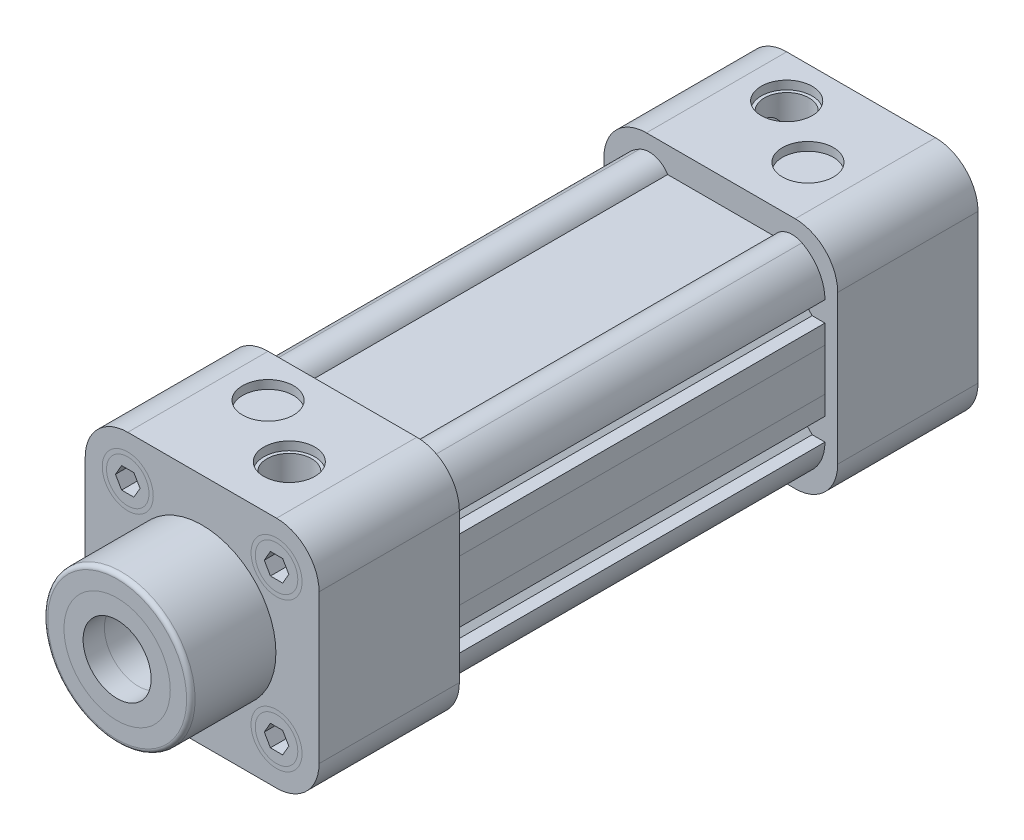
from build123d import *
from build123d.topology import SkipClean

# Parameters (mm, degrees)
IZIM1_W                        = 55
IZIM1_H                        = 55
Y_KSEKLIK_EKSTR_ZYON2_DEPTH    = 155
IZIM2_W                        = 89
IZIM2_H                        = 3.892926892
IZIM2_H_2                      = 3
KES_EKSTR_ZYON3_DEPTH          = 155
IZIM3_W                        = 3
IZIM3_H                        = 89
KES_EKSTR_ZYON4_DEPTH          = 155
IZIM4_W                        = 89
IZIM4_H                        = 3
KES_EKSTR_ZYON5_DEPTH          = 155
IZIM5_W                        = 3
IZIM5_H                        = 89
KES_EKSTR_ZYON6_DEPTH          = 155
KES_EKSTR_ZYON7_DEPTH          = 3
RADYUS1_R                      = 10
RADYUS4_R                      = 5
IZIM7_W                        = 89
IZIM7_H                        = 4.75
IZIM7_H_2                      = 5.25
KES_EKSTR_ZYON8_DEPTH          = 7
PAH1_SIZE                      = 4
IZIM8_W                        = 89
IZIM8_H                        = 10
KES_EKSTR_ZYON9_DEPTH          = 5
IZIM9_W                        = 89
IZIM9_H                        = 10
Y_KSEKLIK_EKSTR_ZYON3_DEPTH    = 5
IZIM10_W                       = 89
IZIM10_H                       = 10
KES_EKSTR_ZYON10_DEPTH         = 2.5
IZIM11_R                       = 17.35
Y_KSEKLIK_EKSTR_ZYON4_DEPTH    = 20
RADYUS5_R                      = 1
IZIM12_R                       = 6
KES_EKSTR_ZYON11_DEPTH         = 20
IZIM13_R                       = 5
Y_KSEKLIK_EKSTR_ZYON5_DEPTH    = 20
Y_KSEKLIK_EKSTR_ZYON5_2_DEPTH  = 20
Y_KSEKLIK_EKSTR_ZYON5_3_DEPTH  = 20
Y_KSEKLIK_EKSTR_ZYON5_4_DEPTH  = 20
KES_EKSTR_ZYON12_DEPTH         = 20
IZIM15_R                       = 5
Y_KSEKLIK_EKSTR_ZYON6_DEPTH    = 15
Y_KSEKLIK_EKSTR_ZYON6_2_DEPTH  = 15
Y_KSEKLIK_EKSTR_ZYON6_3_DEPTH  = 15
Y_KSEKLIK_EKSTR_ZYON6_4_DEPTH  = 15
KES_EKSTR_ZYON14_DEPTH         = 4
IZIM19_R                       = 17.5
Y_KSEKLIK_EKSTR_ZYON7_DEPTH    = 8
IZIM20_R                       = 6
KES_EKSTR_ZYON15_DEPTH         = 2
M12X1_5_START                  = 11.4999999
M12X1_5_TAPPED_HOLE1_DEPTH     = 12.0000002
IZIM22_R                       = 12.5
IZIM22_R_2                     = 8
KES_EKSTR_ZYON16_DEPTH         = 5
IZIM23_R                       = 12.5
IZIM23_R_2                     = 8
Y_KSEKLIK_EKSTR_ZYON8_DEPTH    = 5
IZIM24_R                       = 8
KES_EKSTR_ZYON17_DEPTH         = 150
M6X1_0_TAPPED_HOLE2_AT_2_COUNT = 2
M6X1_0_TAPPED_HOLE2_AT_2_PITCH = 35
M6X1_0_TAPPED_HOLE2_AT_3_COUNT = 2
M6X1_0_TAPPED_HOLE2_AT_3_PITCH = 49.497474683
M6X1_0_TAPPED_HOLE2_AT_4_COUNT = 2
M6X1_0_TAPPED_HOLE2_AT_4_PITCH = 35
IZIM29_R                       = 6
IZIM29_R_2                     = 5
Y_KSEKLIK_EKSTR_ZYON10_DEPTH   = 20
Y_KSEKLIK_EKSTR_ZYON10_2_DEPTH = 20
Y_KSEKLIK_EKSTR_ZYON10_3_DEPTH = 20
Y_KSEKLIK_EKSTR_ZYON10_4_DEPTH = 20
KES_EKSTR_ZYON18_DEPTH         = 0.5


# Read off the part's stored shape, not the designer's step: M12x1.5 Tapped Hole1
with BuildPart() as part:
    # Çizim1 → Yükseklik-Ekstrüzyon2 (new body)
    with BuildSketch(Plane.XY):
        Rectangle(IZIM1_W, IZIM1_H)
    extrude(amount=Y_KSEKLIK_EKSTR_ZYON2_DEPTH)

    # Çizim2 → Kes-Ekstrüzyon3 (cut)
    with BuildSketch(Plane(origin=(27.5, 0, 0), x_dir=(0, 0, -1), z_dir=(1, 0, 0))):
        with Locations((-77.5, 29.446463446)):
            Rectangle(IZIM2_W, IZIM2_H)
        with Locations((-77.5, 26)):
            Rectangle(IZIM2_W, IZIM2_H_2)
    extrude(amount=-KES_EKSTR_ZYON3_DEPTH, mode=Mode.SUBTRACT)

    # Çizim3 → Kes-Ekstrüzyon4 (cut)
    with BuildSketch(Plane(origin=(0, 24.5, 0), x_dir=(1, 0, 0), z_dir=(0, 1, 0))):
        with Locations((-26, -77.5)):
            Rectangle(IZIM3_W, IZIM3_H)
    extrude(amount=-KES_EKSTR_ZYON4_DEPTH, mode=Mode.SUBTRACT)

    # Çizim4 → Kes-Ekstrüzyon5 (cut)
    with BuildSketch(Plane.ZY.offset(24.5)):
        with Locations((77.5, -26)):
            Rectangle(IZIM4_W, IZIM4_H)
    extrude(amount=-KES_EKSTR_ZYON5_DEPTH, mode=Mode.SUBTRACT)

    # Çizim5 → Kes-Ekstrüzyon6 (cut)
    with BuildSketch(Plane.XZ.offset(24.5)):
        with Locations((26, 77.5)):
            Rectangle(IZIM5_W, IZIM5_H)
    extrude(amount=-KES_EKSTR_ZYON6_DEPTH, mode=Mode.SUBTRACT)

    # Çizim6 → Kes-Ekstrüzyon7 (cut)
    with BuildSketch(Plane.XZ.offset(24.5)):
        Polygon((-12.5, 33), (0, 33), (12.5, 33), (12.5, 122), (-12.5, 122), align=None)
    kes_ekstr_zyon7 = extrude(amount=-KES_EKSTR_ZYON7_DEPTH, mode=Mode.SUBTRACT)

    # Radyus1
    radyus1_edges = [part.edges().sort_by_distance(p)[0] for p in [
        (-27.5, 27.5, 16.5),
        (27.5, 27.5, 16.5),
        (-27.5, -27.5, 16.5),
        (-24.5, 24.5, 77.5),
        (27.5, -27.5, 16.5),
        (-24.5, -24.5, 77.5),
        (27.5, -27.5, 138.5),
        (-27.5, -27.5, 138.5),
        (-27.5, 27.5, 138.5),
        (27.5, 27.5, 138.5),
        (24.5, 24.5, 77.5),
        (24.5, -24.5, 77.5),
    ]]
    fillet(radyus1_edges, radius=RADYUS1_R)

    # Aynalama2: Kes-Ekstrüzyon7 across plane
    add(kes_ekstr_zyon7.mirror(Plane.ZX), mode=Mode.SUBTRACT)

    # Radyus4
    # the kernel refuses this fillet: 5 mm, written as the material it takes off along each edge
    with BuildSketch(Plane(origin=(12.5, 24.5, 33), x_dir=(0.9859548247048935, -0.16701222602295537, 0), z_dir=(0, 0, 1)), Plane(origin=(-12.5, 24.5, 122), x_dir=(-0.9859548247048942, -0.16701222602295168, 0), z_dir=(0, 0, -1))) as radyus4_piece_1:
        with BuildLine():
            CenterArc((5.163905461, -4.762761898), RADYUS4_R, 72.279451052, 86.560187232)
            Line((0.501036678, -2.957864474), (0.0347498, -2.777374732))
            ThreePointArc((0.0347498, -2.777374732), (-0.242459073, -1.56243835), (-0.492977412, -0.083506113))
            Line((-0.492977412, -0.083506113), (-0.083506113, 0.492977412))
            ThreePointArc((-0.083506113, 0.492977412), (1.888403536, 0.827001864), (6.837966368, 0.47627619))
            Line((6.837966368, 0.47627619), (6.685779013, 0))
        make_face()
    extrude(amount=89, mode=Mode.SUBTRACT)
    with BuildSketch(Plane(origin=(12.5, -24.5, 33), x_dir=(0, 1, 0), z_dir=(0, 0, 1))) as radyus4_piece_2:
        with BuildLine():
            CenterArc((5.558303418, -4.295938038), RADYUS4_R, 120.774510483, 86.560187232)
            Line((1.116606836, -6.591876075), (0.672437177, -6.821469879))
            ThreePointArc((0.672437177, -6.821469879), (-0.5, -2), (-0.5, 0))
            Line((-0.5, 0), (0, 0.5))
            ThreePointArc((0, 0.5), (1.5, 0.5), (2.744169658, 0.429593804))
            Line((2.744169658, 0.429593804), (3, 0))
        make_face()
    extrude(amount=89, mode=Mode.SUBTRACT)
    with BuildSketch(Plane(origin=(-12.5, -24.5, 122), x_dir=(-0.985954824704894, 0.16701222602295254, 0), z_dir=(0, 0, -1))) as radyus4_piece_3:
        with BuildLine():
            CenterArc((5.163905461, 4.762761898), RADYUS4_R, 201.160361716, 86.560187232)
            Line((0.501036678, 2.957864474), (0.0347498, 2.777374732))
            ThreePointArc((0.0347498, 2.777374732), (-0.242459073, 1.56243835), (-0.492977412, 0.083506113))
            Line((-0.492977412, 0.083506113), (-0.083506113, -0.492977412))
            ThreePointArc((-0.083506113, -0.492977412), (1.888403536, -0.827001864), (6.837966368, -0.47627619))
            Line((6.837966368, -0.47627619), (6.685779013, 0))
        make_face()
    extrude(amount=89, mode=Mode.SUBTRACT)

    # Çizim7 → Kes-Ekstrüzyon8 (cut)
    with BuildSketch(Plane(origin=(24.5, 0, 0), x_dir=(0, 0, -1), z_dir=(1, 0, 0))):
        with Locations((-77.5, 12.125)):
            Rectangle(IZIM7_W, IZIM7_H)
        with Locations((-77.5, -11.875)):
            Rectangle(IZIM7_W, IZIM7_H_2)
    extrude(amount=-KES_EKSTR_ZYON8_DEPTH, mode=Mode.SUBTRACT)

    # Pah1
    # the kernel refuses this chamfer: 4 mm, written as the material it adds along each edge
    with BuildSketch(Plane(origin=(17.5, 9.75, 132.286731952), x_dir=(0.9996219169112968, -0.027495876610586053, 0), z_dir=(0, 0, -1)), Plane(origin=(17.5, 14.5, 22.713268048), x_dir=(0.9996219169112968, 0.027495876610586917, 0), z_dir=(0, 0, 1)), Plane(origin=(17.5, -14.5, 132.286731952), x_dir=(0.9996219169112968, -0.027495876610586053, 0), z_dir=(0, 0, -1)), Plane(origin=(17.5, -9.25, 22.713268048), x_dir=(0.9996219169112968, 0.027495876610586917, 0), z_dir=(0, 0, 1))) as pah1_piece_1:
        Polygon((PAH1_SIZE * 0.999621916911, -PAH1_SIZE * 0.0274958766106), (-PAH1_SIZE * 0.0274958766106, -PAH1_SIZE * 0.999621916911), (0, 0), align=None)
    extrude(amount=109.573463904)

    # Çizim8 → Kes-Ekstrüzyon9 (cut)
    with BuildSketch(Plane(origin=(24.5, 0, 0), x_dir=(0, 0, -1), z_dir=(1, 0, 0))):
        with Locations((-77.5, 0.25)):
            Rectangle(IZIM8_W, IZIM8_H)
    extrude(amount=-KES_EKSTR_ZYON9_DEPTH, mode=Mode.SUBTRACT)

    # Çizim10 → Kes-Ekstrüzyon10 (cut)
    with BuildSketch(Plane.ZY.offset(24.5)):
        with Locations((77.5, 9.5)):
            Rectangle(IZIM10_W, IZIM10_H)
    extrude(amount=-KES_EKSTR_ZYON10_DEPTH, mode=Mode.SUBTRACT)

    # Çizim11 → Yükseklik-Ekstrüzyon4 (add)
    with BuildSketch(Plane.XY.offset(155)):
        Circle(IZIM11_R)
    extrude(amount=Y_KSEKLIK_EKSTR_ZYON4_DEPTH)

    # Radyus5
    radyus5_edges = [part.edges().sort_by_distance(p)[0] for p in [
        (-17.35, 0, 175),
    ]]
    fillet(radyus5_edges, radius=RADYUS5_R)

    # Çizim12 → Kes-Ekstrüzyon11 (cut)
    with BuildSketch(Plane.XY.offset(155)):
        with Locations((17.5, 17.5)):
            Circle(IZIM12_R)
        with Locations((17.5, -17.5)):
            Circle(IZIM12_R)
        with Locations((-17.5, 17.5)):
            Circle(IZIM12_R)
        with Locations((-17.5, -17.5)):
            Circle(IZIM12_R)
    kes_ekstr_zyon11 = extrude(amount=-KES_EKSTR_ZYON11_DEPTH, mode=Mode.SUBTRACT)


with BuildPart() as body_2:
    # Çizim9 → Yükseklik-Ekstrüzyon3 (new body)
    with BuildSketch(Plane(origin=(19.5, 0, 0), x_dir=(0, 0, -1), z_dir=(1, 0, 0))):
        with Locations((-77.5, 0.25)):
            Rectangle(IZIM9_W, IZIM9_H)
    extrude(amount=Y_KSEKLIK_EKSTR_ZYON3_DEPTH)


with BuildPart() as body_3:
    # Çizim13 → Yükseklik-Ekstrüzyon5 (new body)
    with BuildSketch(Plane.XY.offset(135)):
        with Locations((17.5, -17.5)):
            Circle(IZIM13_R)
    y_kseklik_ekstr_zyon5 = extrude(amount=Y_KSEKLIK_EKSTR_ZYON5_DEPTH)


with BuildPart() as body_4:
    # Çizim13 → Y_kseklik-Ekstr_zyon5 2 (new body)
    with BuildSketch(Plane.XY.offset(135)):
        with Locations((17.5, 17.5)):
            Circle(IZIM13_R)
    y_kseklik_ekstr_zyon5_2 = extrude(amount=Y_KSEKLIK_EKSTR_ZYON5_2_DEPTH)


with BuildPart() as body_5:
    # Çizim13 → Y_kseklik-Ekstr_zyon5 3 (new body)
    with BuildSketch(Plane.XY.offset(135)):
        with Locations((-17.5, 17.5)):
            Circle(IZIM13_R)
    y_kseklik_ekstr_zyon5_3 = extrude(amount=Y_KSEKLIK_EKSTR_ZYON5_3_DEPTH)


with BuildPart() as body_6:
    # Çizim13 → Y_kseklik-Ekstr_zyon5 4 (new body)
    with BuildSketch(Plane.XY.offset(135)):
        with Locations((-17.5, -17.5)):
            Circle(IZIM13_R)
    y_kseklik_ekstr_zyon5_4 = extrude(amount=Y_KSEKLIK_EKSTR_ZYON5_4_DEPTH)


with BuildPart() as kes_ekstr_zyon12_tool:
    # Çizim14 → Kes-Ekstrüzyon12 (new body)
    with BuildSketch(Plane.XY.offset(155)):
        Polygon((20.386751346, -17.5), (18.943375673, -15), (16.056624327, -15), (14.613248654, -17.5), (16.056624327, -20), (18.943375673, -20), align=None)
        Polygon((-14.613248654, -17.5), (-16.056624327, -15), (-18.943375673, -15), (-20.386751346, -17.5), (-18.943375673, -20), (-16.056624327, -20), align=None)
        Polygon((-14.613248654, 17.5), (-16.056624327, 20), (-18.943375673, 20), (-20.386751346, 17.5), (-18.943375673, 15), (-16.056624327, 15), align=None)
        Polygon((20.386751346, 17.5), (18.943375673, 20), (16.056624327, 20), (14.613248654, 17.5), (16.056624327, 15), (18.943375673, 15), align=None)
    kes_ekstr_zyon12 = extrude(amount=-KES_EKSTR_ZYON12_DEPTH)


with BuildPart() as body_3_1:
    add(body_3.part)

    # Kes-Ekstrüzyon12: cut by kes_ekstr_zyon12_tool
    add(kes_ekstr_zyon12_tool.part, mode=Mode.SUBTRACT)


with BuildPart() as body_4_1:
    add(body_4.part)

    # Kes-Ekstrüzyon12: cut by kes_ekstr_zyon12_tool
    add(kes_ekstr_zyon12_tool.part, mode=Mode.SUBTRACT)


with BuildPart() as body_5_1:
    add(body_5.part)

    # Kes-Ekstrüzyon12: cut by kes_ekstr_zyon12_tool
    add(kes_ekstr_zyon12_tool.part, mode=Mode.SUBTRACT)


with BuildPart() as body_6_1:
    add(body_6.part)

    # Kes-Ekstrüzyon12: cut by kes_ekstr_zyon12_tool
    add(kes_ekstr_zyon12_tool.part, mode=Mode.SUBTRACT)


with BuildPart() as part_1:
    add(part.part)

    # Aynalama3: Kes-Ekstrüzyon11, Yükseklik-Ekstrüzyon5, Y_kseklik-Ekstr_zyon5 2, Y_kseklik-Ekstr_zyon5 3, Y_kseklik-Ekstr_zyon5 4, Kes-Ekstrüzyon12 across plane
    add(kes_ekstr_zyon11.mirror(Plane.XY.offset(75)), mode=Mode.SUBTRACT)
    add(y_kseklik_ekstr_zyon5.mirror(Plane.XY.offset(75)), mode=Mode.SUBTRACT)
    add(y_kseklik_ekstr_zyon5_2.mirror(Plane.XY.offset(75)), mode=Mode.SUBTRACT)
    add(y_kseklik_ekstr_zyon5_3.mirror(Plane.XY.offset(75)), mode=Mode.SUBTRACT)
    add(y_kseklik_ekstr_zyon5_4.mirror(Plane.XY.offset(75)), mode=Mode.SUBTRACT)
    add(kes_ekstr_zyon12.mirror(Plane.XY.offset(75)), mode=Mode.SUBTRACT)


with BuildPart() as body_7:
    # Çizim15 → Yükseklik-Ekstrüzyon6 (new body)
    with BuildSketch(Plane(origin=(0, 0, 15), x_dir=(-1, 0, 0), z_dir=(0, 0, -1))):
        with Locations(Location((17.5, 17.5, 0), (0, 0, 180))):
            Circle(IZIM15_R)
    extrude(amount=Y_KSEKLIK_EKSTR_ZYON6_DEPTH)


with BuildPart() as body_8:
    # Çizim15 → Y_kseklik-Ekstr_zyon6 2 (new body)
    with BuildSketch(Plane(origin=(0, 0, 15), x_dir=(-1, 0, 0), z_dir=(0, 0, -1))):
        with Locations(Location((-17.5, 17.5, 0), (0, 0, 180))):
            Circle(IZIM15_R)
    extrude(amount=Y_KSEKLIK_EKSTR_ZYON6_2_DEPTH)


with BuildPart() as body_9:
    # Çizim15 → Y_kseklik-Ekstr_zyon6 3 (new body)
    with BuildSketch(Plane(origin=(0, 0, 15), x_dir=(-1, 0, 0), z_dir=(0, 0, -1))):
        with Locations(Location((-17.5, -17.5, 0), (0, 0, 180))):
            Circle(IZIM15_R)
    extrude(amount=Y_KSEKLIK_EKSTR_ZYON6_3_DEPTH)


with BuildPart() as body_10:
    # Çizim15 → Y_kseklik-Ekstr_zyon6 4 (new body)
    with BuildSketch(Plane(origin=(0, 0, 15), x_dir=(-1, 0, 0), z_dir=(0, 0, -1))):
        with Locations(Location((17.5, -17.5, 0), (0, 0, 180))):
            Circle(IZIM15_R)
    extrude(amount=Y_KSEKLIK_EKSTR_ZYON6_4_DEPTH)


with BuildPart() as kes_ekstr_zyon14_tool:
    # Çizim18 → Kes-Ekstrüzyon14 (new body)
    with SkipClean():  # the faces are left unmerged after this step: merging them gives an invalid solid
        with BuildSketch(Plane(origin=(0, 0, 0), x_dir=(-1, 0, 0), z_dir=(0, 0, -1))):
            with BuildLine():
                Line((17.5, 23.5), (-17.5, 23.5))
                ThreePointArc((-17.5, 23.5), (-21.742640687, 21.742640687), (-23.5, 17.5))
                Line((-23.5, 17.5), (-23.5, -17.5))
                ThreePointArc((-23.5, -17.5), (-21.742640687, -21.742640687), (-17.5, -23.5))
                Line((-17.5, -23.5), (17.5, -23.5))
                ThreePointArc((17.5, -23.5), (21.742640687, -21.742640687), (23.5, -17.5))
                Line((23.5, -17.5), (23.5, 17.5))
                ThreePointArc((23.5, 17.5), (21.742640687, 21.742640687), (17.5, 23.5))
            make_face()
        extrude(amount=-KES_EKSTR_ZYON14_DEPTH)


with BuildPart() as part_2:
    with SkipClean():  # the faces are left unmerged after this step: merging them gives an invalid solid
        add(part_1.part)

        # Kes-Ekstrüzyon14: cut by kes_ekstr_zyon14_tool
        add(kes_ekstr_zyon14_tool.part, mode=Mode.SUBTRACT)



with BuildPart() as body_7_1:
    with SkipClean():  # the faces are left unmerged after this step: merging them gives an invalid solid
        add(body_7.part)

        # Kes-Ekstrüzyon14: cut by kes_ekstr_zyon14_tool
        add(kes_ekstr_zyon14_tool.part, mode=Mode.SUBTRACT)


with BuildPart() as body_8_1:
    with SkipClean():  # the faces are left unmerged after this step: merging them gives an invalid solid
        add(body_8.part)

        # Kes-Ekstrüzyon14: cut by kes_ekstr_zyon14_tool
        add(kes_ekstr_zyon14_tool.part, mode=Mode.SUBTRACT)


with BuildPart() as body_9_1:
    with SkipClean():  # the faces are left unmerged after this step: merging them gives an invalid solid
        add(body_9.part)

        # Kes-Ekstrüzyon14: cut by kes_ekstr_zyon14_tool
        add(kes_ekstr_zyon14_tool.part, mode=Mode.SUBTRACT)


with BuildPart() as body_10_1:
    with SkipClean():  # the faces are left unmerged after this step: merging them gives an invalid solid
        add(body_10.part)

        # Kes-Ekstrüzyon14: cut by kes_ekstr_zyon14_tool
        add(kes_ekstr_zyon14_tool.part, mode=Mode.SUBTRACT)


with BuildPart() as part_3:
    with SkipClean():  # the faces are left unmerged after this step: merging them gives an invalid solid
        add(part_2.part)

        add(body_7_1.part)  # Yükseklik-Ekstrüzyon7 merges body 7

        add(body_8_1.part)  # Yükseklik-Ekstrüzyon7 merges body 8

        add(body_9_1.part)  # Yükseklik-Ekstrüzyon7 merges body 9

        add(body_10_1.part)  # Yükseklik-Ekstrüzyon7 merges body 10
        # Çizim19 → Yükseklik-Ekstrüzyon7 (add)
        with BuildSketch(Plane(origin=(0, 0, 4), x_dir=(-1, 0, 0), z_dir=(0, 0, -1))):
            Circle(IZIM19_R)
        extrude(amount=Y_KSEKLIK_EKSTR_ZYON7_DEPTH)

    # Çizim20 → Kes-Ekstrüzyon15 (cut)
    with SkipClean():  # the faces are left unmerged after this step: merging them gives an invalid solid
        with BuildSketch(Plane(origin=(0, 27.5, 0), x_dir=(1, 0, 0), z_dir=(0, 1, 0))):
            with Locations(Location((-7.5, -10, 0), (0, 0, 270))):
                Circle(IZIM20_R)
            with Locations(Location((-7.5, -132, 0), (0, 0, 270))):
                Circle(IZIM20_R)
            with Locations(Location((7.5, -20, 0), (0, 0, 270))):
                Circle(IZIM20_R)
            with Locations(Location((7.5, -142, 0), (0, 0, 270))):
                Circle(IZIM20_R)
        extrude(amount=-KES_EKSTR_ZYON15_DEPTH, mode=Mode.SUBTRACT)


with BuildPart() as m12x1_5_tapped_hole1_tool:
    # M12x1.5 Tapped Hole1 outline → M12x1.5 Tapped Hole1 (new body)
    with SkipClean():  # the faces are left unmerged after this step: merging them gives an invalid solid
        with BuildSketch(Plane(origin=(0, 0, 0), x_dir=(1, 0, 0), z_dir=(0, 1, 0)).offset(M12X1_5_START)):
            with BuildLine():
                ThreePointArc((12.499858445, -140.398776865), (2.250000005, -142.000231983), (12.499999933, -143.60078127))
                ThreePointArc((12.499999933, -143.60078127), (12.749999995, -141.999768018), (12.499858445, -140.398776865))
            make_face()
            with BuildLine():
                ThreePointArc((-12.499858445, -11.601223135), (-2.250000005, -9.999768017), (-12.499999933, -8.39921873))
                ThreePointArc((-12.499999933, -8.39921873), (-12.749999995, -10.000231982), (-12.499858445, -11.601223135))
            make_face()
        extrude(amount=M12X1_5_TAPPED_HOLE1_DEPTH)


with BuildPart() as part_4:
    with SkipClean():  # the faces are left unmerged after this step: merging them gives an invalid solid
        add(part_3.part)

        # M12x1.5 Tapped Hole1: cut by m12x1_5_tapped_hole1_tool
        add(m12x1_5_tapped_hole1_tool.part, mode=Mode.SUBTRACT)

    # M12x1.5 Tapped Hole1 2 outline → M12x1.5 Tapped Hole1 2 (revolve, cut)
    with BuildSketch(Plane(origin=(7.5, 0, 142), x_dir=(1, 0, 0), z_dir=(0, 0, 1))):
        Polygon((0, 7.34548175), (5.25, 10.5), (5.25, 25.5), (0, 25.5), align=None)
    revolve(axis=Axis((7.5, 0, 142), (0, 1, 0)), mode=Mode.SUBTRACT)

    # M12x1.5 Tapped Hole1 3 outline → M12x1.5 Tapped Hole1 3 (revolve, cut)
    with BuildSketch(Plane(origin=(-7.5, 0, 10), x_dir=(1, 0, 0), z_dir=(0, 0, 1))):
        Polygon((0, 25.5), (0, 7.34548175), (5.25, 10.5), (5.25, 25.5), align=None)
    revolve(axis=Axis((-7.5, 0, 10), (0, 1, 0)), mode=Mode.SUBTRACT)

    # Çizim22 → Kes-Ekstrüzyon16 (cut)
    with BuildSketch(Plane.XY.offset(175)):
        Circle(IZIM22_R)
        Circle(IZIM22_R_2, mode=Mode.SUBTRACT)
    extrude(amount=-KES_EKSTR_ZYON16_DEPTH, mode=Mode.SUBTRACT)

    # Çizim24 → Kes-Ekstrüzyon17 (cut)
    with BuildSketch(Plane.XY.offset(175)):
        Circle(IZIM24_R)
    extrude(amount=-KES_EKSTR_ZYON17_DEPTH, mode=Mode.SUBTRACT)

    # Çizim27 → M6x1.0 Tapped Hole2 (revolve, cut)
    with BuildSketch(Plane(origin=(17.5, -17.5, 4), x_dir=(0, 1, 0), z_dir=(1, 0, 0))):
        Polygon((0, 0), (0, 29.502151548), (2.5, 28), (2.5, 0), align=None)
    m6x1_0_tapped_hole2 = revolve(axis=Axis((17.5, -17.5, -2.35), (0, 0, 1)), mode=Mode.SUBTRACT)

    # M6x1.0 Tapped Hole2 at 2: M6x1.0 Tapped Hole2 ×2
    with Locations(*[(0, i * M6X1_0_TAPPED_HOLE2_AT_2_PITCH, 0) for i in range(1, M6X1_0_TAPPED_HOLE2_AT_2_COUNT)]):
        add(m6x1_0_tapped_hole2, mode=Mode.SUBTRACT)

    # M6x1.0 Tapped Hole2 at 3: M6x1.0 Tapped Hole2 ×2
    with Locations(*[Vector(-0.7071067811865477, 0.7071067811865475, 0) * (i * M6X1_0_TAPPED_HOLE2_AT_3_PITCH) for i in range(1, M6X1_0_TAPPED_HOLE2_AT_3_COUNT)]):
        add(m6x1_0_tapped_hole2, mode=Mode.SUBTRACT)

    # M6x1.0 Tapped Hole2 at 4: M6x1.0 Tapped Hole2 ×2
    with Locations(*[(-i * M6X1_0_TAPPED_HOLE2_AT_4_PITCH, 0, 0) for i in range(1, M6X1_0_TAPPED_HOLE2_AT_4_COUNT)]):
        add(m6x1_0_tapped_hole2, mode=Mode.SUBTRACT)

    # Çizim30 → Kes-Ekstrüzyon18 (cut)
    # profile 1 of 8: a face of its own
    with BuildSketch(Plane(origin=(0, 0, -4), x_dir=(-1, 0, 0), z_dir=(0, 0, -1))):
        Polygon((-9.931337125, 2.568693398), (-8.31595251, -0.931306602), (-8.657398824, -0.931306602), (-9.174826709, 0.19048827), (-10.76146533, 0.19048827), (-11.293616773, -0.931306602), (-11.63646533, -0.931306602), (-9.97620892, 2.568693398), align=None)
        Polygon((-9.957278632, 1.886501892), (-10.591092734, 0.549462629), (-9.340291452, 0.549462629), align=None, mode=Mode.SUBTRACT)
    # profile 2 of 8: a face of its own
    with BuildSketch(Plane(origin=(0, 0, -4), x_dir=(-1, 0, 0), z_dir=(0, 0, -1))):
        Polygon((-8.091593536, 2.209719039), (-8.091593536, 2.568693398), (-6.251849946, 2.568693398), (-6.251849946, 2.209719039), (-7.014670459, 2.209719039), (-7.014670459, -0.931306602), (-7.328773023, -0.931306602), (-7.328773023, 2.209719039), align=None)
    # profile 3 of 8: a face of its own
    with BuildSketch(Plane(origin=(0, 0, -4), x_dir=(-1, 0, 0), z_dir=(0, 0, -1))):
        Polygon((-4.277490971, 2.568693398), (-2.662106356, -0.931306602), (-3.00355267, -0.931306602), (-3.520980555, 0.19048827), (-5.107619177, 0.19048827), (-5.639770619, -0.931306602), (-5.982619177, -0.931306602), (-4.322362766, 2.568693398), align=None)
        Polygon((-4.303432478, 1.886501892), (-4.93724658, 0.549462629), (-3.686445298, 0.549462629), align=None, mode=Mode.SUBTRACT)
    # profile 4 of 8: a face of its own
    with BuildSketch(Plane(origin=(0, 0, -4), x_dir=(-1, 0, 0), z_dir=(0, 0, -1))):
        with BuildLine():
            Line((-2.392875587, -0.256126313), (-2.097002189, -0.078742499))
            add(Edge.make_bspline(
                [(-2.097002189, -0.078742499), (-2.069483952, -0.124806884), (-2.016760071, -0.213064468), (-1.928808712, -0.332322508), (-1.837675801, -0.433684665), (-1.742686468, -0.516561273), (-1.644420519, -0.58181016), (-1.542236466, -0.628012391), (-1.436478655, -0.656828367), (-1.364504834, -0.660328453), (-1.328572702, -0.662075833)],
                knots=[0, 0, 0, 0, 1.272034388, 2.437168799, 3.508375237, 4.49857839, 5.41946034, 6.295179144, 7.148887113, 8, 8, 8, 8], degree=3))
            add(Edge.make_bspline(
                [(-1.328572702, -0.662075833), (-1.297885842, -0.66122116), (-1.237049069, -0.65952677), (-1.147486826, -0.643245968), (-1.060505023, -0.618233839), (-0.977896386, -0.582412907), (-0.900800771, -0.539074422), (-0.833194076, -0.486728244), (-0.774747963, -0.428122038), (-0.726938848, -0.362739384), (-0.690258813, -0.292422235), (-0.662066744, -0.220246284), (-0.646421671, -0.145077715), (-0.644064917, -0.094467253), (-0.642875587, -0.068926794)],
                knots=[0, 0, 0, 0, 1.095163259, 2.171163733, 3.241058638, 4.321873601, 5.38011039, 6.391990106, 7.366004449, 8.327778327, 9.272591725, 10.192022065, 11.087607919, 12, 12, 12, 12], degree=3))
            add(Edge.make_bspline(
                [(-0.642875587, -0.068926794), (-0.644349897, -0.039785944), (-0.647346956, 0.019453145), (-0.672678436, 0.106852798), (-0.712527683, 0.193345368), (-0.749290326, 0.246846633), (-0.768376388, 0.274622885)],
                knots=[0, 0, 0, 0, 0.938893495, 1.908633276, 2.914225137, 4, 4, 4, 4], degree=3))
            add(Edge.make_bspline(
                [(-0.768376388, 0.274622885), (-0.784047002, 0.294669709), (-0.816945497, 0.336755508), (-0.873503009, 0.399400743), (-0.939869123, 0.464019162), (-1.013772678, 0.533078219), (-1.097905767, 0.603366016), (-1.189633282, 0.678234294), (-1.291297141, 0.754835871), (-1.362596637, 0.806208436), (-1.399386003, 0.832715834)],
                knots=[0, 0, 0, 0, 0.722233717, 1.516239348, 2.393582979, 3.351407094, 4.387010283, 5.505090956, 6.712668013, 8, 8, 8, 8], degree=3))
            add(Edge.make_bspline(
                [(-1.399386003, 0.832715834), (-1.43621, 0.858944422), (-1.506614676, 0.909091484), (-1.605073259, 0.983515768), (-1.693117722, 1.051559638), (-1.770356738, 1.11386365), (-1.836756335, 1.170436254), (-1.892839746, 1.220734194), (-1.937178303, 1.266117754), (-1.961833884, 1.295559096), (-1.972903632, 1.308777533)],
                knots=[0, 0, 0, 0, 1.452282411, 2.77665338, 3.964542531, 5.026858415, 5.96415736, 6.766646006, 7.446254459, 8, 8, 8, 8], degree=3))
            add(Edge.make_bspline(
                [(-1.972903632, 1.308777533), (-1.988376177, 1.32937857), (-2.018805014, 1.369893273), (-2.058971019, 1.433218131), (-2.093110182, 1.498041397), (-2.119872514, 1.564537261), (-2.142408733, 1.63177219), (-2.157566664, 1.700623436), (-2.16705806, 1.770782054), (-2.168030047, 1.817995555), (-2.168516612, 1.841630097)],
                knots=[0, 0, 0, 0, 1.068054152, 2.10047183, 3.106115577, 4.101338837, 5.06977816, 6.043150881, 7.020423561, 8, 8, 8, 8], degree=3))
            add(Edge.make_bspline(
                [(-2.168516612, 1.841630097), (-2.167211403, 1.878659872), (-2.164628883, 1.951927935), (-2.142788366, 2.058958766), (-2.108315472, 2.161145183), (-2.060020585, 2.257475517), (-1.997763232, 2.345441498), (-1.925717257, 2.426054985), (-1.839905771, 2.493823567), (-1.745753148, 2.553035625), (-1.642696776, 2.59938155), (-1.534705872, 2.63434253), (-1.4216088, 2.654151788), (-1.345005666, 2.656994553), (-1.306136805, 2.658436988)],
                knots=[0, 0, 0, 0, 1.005424448, 1.989358655, 2.955360095, 3.929531133, 4.905563448, 5.876582895, 6.856512386, 7.866279853, 8.892233794, 9.918561126, 10.94386622, 12, 12, 12, 12], degree=3))
            add(Edge.make_bspline(
                [(-1.306136805, 2.658436988), (-1.264892704, 2.657014436), (-1.182871353, 2.654185435), (-1.062222137, 2.629587904), (-0.946061421, 2.588887232), (-0.852618156, 2.542698574), (-0.779485394, 2.496567158), (-0.723712662, 2.454547334), (-0.667195211, 2.406172226), (-0.609477156, 2.35131298), (-0.551536497, 2.289466228), (-0.492513044, 2.22105554), (-0.432268776, 2.146498984), (-0.393512916, 2.093274483), (-0.373644818, 2.065989071)],
                knots=[0, 0, 0, 0, 1.286793592, 2.559021753, 3.825965368, 5.121522368, 5.803751409, 6.523245864, 7.299691795, 8.125521123, 9.008227632, 9.944561021, 10.946284179, 12, 12, 12, 12], degree=3))
            Line((-0.373644818, 2.065989071), (-0.657599144, 1.85074468))
            add(Edge.make_bspline(
                [(-0.657599144, 1.85074468), (-0.674745077, 1.872833371), (-0.707764134, 1.915371024), (-0.757893621, 1.97494234), (-0.805142269, 2.029358819), (-0.851692669, 2.076623947), (-0.8950863, 2.11932608), (-0.937203342, 2.155885837), (-0.977437694, 2.186661433), (-1.028154604, 2.219504993), (-1.091872323, 2.252061496), (-1.171856859, 2.279610574), (-1.255443134, 2.296165636), (-1.312372765, 2.298354524), (-1.341192894, 2.299462629)],
                knots=[0, 0, 0, 0, 1.181633172, 2.275549214, 3.290209073, 4.226197932, 5.078386478, 5.862611352, 6.581680152, 7.217281963, 8.414376989, 9.595101626, 10.782541182, 12, 12, 12, 12], degree=3))
            add(Edge.make_bspline(
                [(-1.341192894, 2.299462629), (-1.377349417, 2.298250929), (-1.447073864, 2.29591428), (-1.5460641, 2.270394295), (-1.635158025, 2.230212434), (-1.711710591, 2.173897456), (-1.775447568, 2.107176463), (-1.821553026, 2.030397608), (-1.849303191, 1.945615206), (-1.852689471, 1.886473549), (-1.854414048, 1.856353655)],
                knots=[0, 0, 0, 0, 1.14458467, 2.207223713, 3.21896685, 4.227309161, 5.202851033, 6.127160689, 7.046193047, 8, 8, 8, 8], degree=3))
            add(Edge.make_bspline(
                [(-1.854414048, 1.856353655), (-1.854020922, 1.837602176), (-1.853234026, 1.800068557), (-1.842259228, 1.744617135), (-1.828159899, 1.689305795), (-1.805817267, 1.634383212), (-1.774971964, 1.578888853), (-1.734466788, 1.521867116), (-1.683453476, 1.462815407), (-1.644376463, 1.424408033), (-1.623744978, 1.404130097)],
                knots=[0, 0, 0, 0, 0.858281714, 1.717966888, 2.583508476, 3.4729293, 4.427298488, 5.488583878, 6.674047936, 8, 8, 8, 8], degree=3))
            add(Edge.make_bspline(
                [(-1.623744978, 1.404130097), (-1.616083605, 1.397293071), (-1.597881938, 1.381049863), (-1.564606013, 1.354457582), (-1.520663214, 1.32165481), (-1.467201013, 1.281067493), (-1.403233651, 1.233986031), (-1.328754095, 1.181012419), (-1.244592562, 1.12042696), (-1.184870647, 1.078069419), (-1.153292253, 1.055672565)],
                knots=[0, 0, 0, 0, 0.420754252, 0.999615792, 1.744751191, 2.668019286, 3.750313428, 4.999500688, 6.413464383, 8, 8, 8, 8], degree=3))
            add(Edge.make_bspline(
                [(-1.153292253, 1.055672565), (-1.11530634, 1.028031205), (-1.041751884, 0.974507544), (-0.937094304, 0.894091864), (-0.842200496, 0.815444095), (-0.756737292, 0.739066488), (-0.679860384, 0.665538395), (-0.612422663, 0.593975215), (-0.553736983, 0.524889642), (-0.490557764, 0.436317066), (-0.425999945, 0.327535982), (-0.370558437, 0.194257743), (-0.33560009, 0.060461423), (-0.331028574, -0.029465414), (-0.328773023, -0.073834647)],
                knots=[0, 0, 0, 0, 1.163667725, 2.253281268, 3.268753668, 4.215851969, 5.092017293, 5.902905408, 6.650798638, 7.335211899, 8.59617414, 9.77448103, 10.901945474, 12, 12, 12, 12], degree=3))
            add(Edge.make_bspline(
                [(-0.328773023, -0.073834647), (-0.329430161, -0.105213012), (-0.330731676, -0.167360395), (-0.34569259, -0.258615472), (-0.367612255, -0.347246342), (-0.400649489, -0.432157454), (-0.440972647, -0.514902217), (-0.492138895, -0.593310117), (-0.55144658, -0.669116516), (-0.619480345, -0.740300007), (-0.693926247, -0.805646203), (-0.772609942, -0.863775265), (-0.855660214, -0.912243588), (-0.942626531, -0.95179443), (-1.033528868, -0.982727948), (-1.128336652, -1.005140817), (-1.227206163, -1.018896528), (-1.294406644, -1.020324289), (-1.328572702, -1.021050192)],
                knots=[0, 0, 0, 0, 0.983748083, 1.948392443, 2.894712957, 3.844097841, 4.80183111, 5.778335162, 6.776009319, 7.81870978, 8.863265674, 9.881300176, 10.883814829, 11.87499822, 12.874611388, 13.892143829, 14.928324115, 16, 16, 16, 16], degree=3))
            add(Edge.make_bspline(
                [(-1.328572702, -1.021050192), (-1.355008045, -1.02053901), (-1.407545805, -1.019523085), (-1.485255287, -1.010541804), (-1.561394876, -0.997834701), (-1.635009158, -0.977660631), (-1.70704657, -0.953183653), (-1.777193804, -0.923045321), (-1.845484858, -0.886928119), (-1.912302441, -0.845633095), (-1.977476616, -0.79757535), (-2.040396084, -0.741601854), (-2.103125269, -0.679256349), (-2.163812666, -0.608845785), (-2.22368581, -0.531507703), (-2.281564219, -0.446518519), (-2.338645937, -0.354341165), (-2.374461405, -0.28947608), (-2.392875587, -0.256126313)],
                knots=[0, 0, 0, 0, 0.915332311, 1.819136955, 2.706846663, 3.586547465, 4.459518054, 5.340707479, 6.227863349, 7.133153174, 8.059268498, 9.028702269, 10.047606654, 11.120612155, 12.245963614, 13.433783089, 14.680604001, 16, 16, 16, 16], degree=3))
        make_face()
    # profile 5 of 8: a face of its own
    with BuildSketch(Plane(origin=(0, 0, -4), x_dir=(-1, 0, 0), z_dir=(0, 0, -1))):
        Polygon((0.389175695, 2.568693398), (2.36353467, 2.568693398), (2.36353467, 2.209719039), (0.703278259, 2.209719039), (0.703278259, 1.132795962), (2.36353467, 1.132795962), (2.36353467, 0.773821603), (0.703278259, 0.773821603), (0.703278259, -0.572332243), (2.36353467, -0.572332243), (2.36353467, -0.931306602), (0.389175695, -0.931306602), align=None)
    # profile 6 of 8: a face of its own
    with BuildSketch(Plane(origin=(0, 0, -4), x_dir=(-1, 0, 0), z_dir=(0, 0, -1))):
        Polygon((2.722509029, 2.568693398), (3.05904749, 2.568693398), (4.225714157, -0.189519743), (5.392380823, 2.568693398), (5.728919285, 2.568693398), (4.248150054, -0.931306602), (4.203278259, -0.931306602), align=None)
    # profile 7 of 8: a face of its own
    with BuildSketch(Plane(origin=(0, 0, -4), x_dir=(-1, 0, 0), z_dir=(0, 0, -1))):
        Polygon((6.357124413, 2.568693398), (8.331483388, 2.568693398), (8.331483388, 2.209719039), (6.671226977, 2.209719039), (6.671226977, 1.132795962), (8.331483388, 1.132795962), (8.331483388, 0.773821603), (6.671226977, 0.773821603), (6.671226977, -0.572332243), (8.331483388, -0.572332243), (8.331483388, -0.931306602), (6.357124413, -0.931306602), align=None)
    # profile 8 of 8: a face of its own
    with BuildSketch(Plane(origin=(0, 0, -4), x_dir=(-1, 0, 0), z_dir=(0, 0, -1))):
        with BuildLine():
            Line((8.959688516, 2.568693398), (9.660109189, 2.568693398))
            add(Edge.make_bspline(
                [(9.660109189, 2.568693398), (9.706850317, 2.568537812), (9.796598462, 2.56823907), (9.925171732, 2.566573307), (10.041998829, 2.561798951), (10.147018668, 2.557690368), (10.240229323, 2.550198427), (10.321916614, 2.543037779), (10.391704312, 2.533664119), (10.433950163, 2.524958696), (10.453077939, 2.521017116)],
                knots=[0, 0, 0, 0, 1.410062039, 2.707475311, 3.878576406, 4.937260626, 5.877586885, 6.699081471, 7.410979367, 8, 8, 8, 8], degree=3))
            add(Edge.make_bspline(
                [(10.453077939, 2.521017116), (10.478684563, 2.514690351), (10.529351552, 2.502171787), (10.602301618, 2.475712186), (10.671815942, 2.445092562), (10.737605767, 2.409128841), (10.799341558, 2.367554062), (10.857659869, 2.321085939), (10.912825332, 2.269978734), (10.962606962, 2.212943892), (11.009546014, 2.153107382), (11.049134641, 2.088403626), (11.08326112, 2.020742098), (11.110431637, 1.94943468), (11.132309611, 1.875172908), (11.14773585, 1.797284112), (11.156987038, 1.716123137), (11.157928893, 1.660765228), (11.158406464, 1.632695802)],
                knots=[0, 0, 0, 0, 1.027469482, 2.033020251, 3.019912614, 3.986113645, 4.951240523, 5.91722682, 6.890402269, 7.87763091, 8.8651537, 9.85103654, 10.82876324, 11.815024772, 12.821070561, 13.842952187, 14.906261191, 16, 16, 16, 16], degree=3))
            add(Edge.make_bspline(
                [(11.158406464, 1.632695802), (11.156937466, 1.586060697), (11.154071071, 1.49506353), (11.127345967, 1.363002648), (11.083569447, 1.239813334), (11.023246158, 1.125650696), (10.946426682, 1.02274005), (10.854101891, 0.932349595), (10.74622028, 0.856709682), (10.645790964, 0.804256878), (10.557076764, 0.770663969), (10.484043451, 0.74702761), (10.404376474, 0.728765645), (10.318839139, 0.712405513), (10.227075484, 0.700053819), (10.129305444, 0.691007224), (10.025459293, 0.685353176), (9.954120223, 0.684511171), (9.917420888, 0.684078014)],
                knots=[0, 0, 0, 0, 1.260483769, 2.459530307, 3.627416485, 4.787058657, 5.939039949, 7.08810263, 8.267026773, 9.491475466, 10.141966685, 10.831826277, 11.566392101, 12.351337768, 13.187381173, 14.07005841, 15.007169909, 16, 16, 16, 16], degree=3))
            Line((9.917420888, 0.684078014), (11.203278259, -0.931306602))
            Line((11.203278259, -0.931306602), (10.814856785, -0.931306602))
            Line((10.814856785, -0.931306602), (9.528999413, 0.684078014))
            Line((9.528999413, 0.684078014), (9.27379108, 0.684078014))
            Line((9.27379108, 0.684078014), (9.27379108, -0.931306602))
            Line((9.27379108, -0.931306602), (8.959688516, -0.931306602))
            Line((8.959688516, -0.931306602), (8.959688516, 2.568693398))
        make_face()
        with BuildLine():
            Line((9.27379108, 2.209719039), (9.27379108, 1.043052373))
            Line((9.27379108, 1.043052373), (9.9146164, 1.03814452))
            add(Edge.make_bspline(
                [(9.9146164, 1.03814452), (9.944536439, 1.038131283), (10.002529996, 1.038105627), (10.086430661, 1.042099403), (10.164550773, 1.046642721), (10.236591525, 1.053592067), (10.3025851, 1.062548139), (10.362498514, 1.073751123), (10.416429566, 1.086803186), (10.479328104, 1.107004811), (10.549564635, 1.13901083), (10.625896095, 1.185576328), (10.690898433, 1.244145448), (10.745816295, 1.311118904), (10.789945727, 1.384755152), (10.821057781, 1.464171522), (10.840800223, 1.54736312), (10.843128769, 1.604541227), (10.8443039, 1.633396924)],
                knots=[0, 0, 0, 0, 1.146690395, 2.22261258, 3.21895312, 4.145990853, 4.996080663, 5.770904154, 6.481378293, 7.121626537, 8.300444488, 9.431385265, 10.535395872, 11.636531494, 12.74115979, 13.810798291, 14.895190096, 16, 16, 16, 16], degree=3))
            add(Edge.make_bspline(
                [(10.8443039, 1.633396924), (10.843101779, 1.661543498), (10.840719614, 1.717319736), (10.821270845, 1.798975647), (10.788381464, 1.876042597), (10.744059226, 1.948207082), (10.690060071, 2.013712818), (10.626742258, 2.069759971), (10.555837063, 2.116009435), (10.489565865, 2.145563816), (10.430331652, 2.163683669), (10.378901992, 2.176434833), (10.320790515, 2.186679302), (10.255715056, 2.194887363), (10.183953425, 2.201942307), (10.105142774, 2.206694086), (10.019805994, 2.20950795), (9.960659063, 2.209647039), (9.93004108, 2.209719039)],
                knots=[0, 0, 0, 0, 1.101028733, 2.181837193, 3.264309656, 4.369019818, 5.486613113, 6.575447106, 7.666700264, 8.788928104, 9.402425223, 10.0903467, 10.862060571, 11.710948788, 12.657782767, 13.684531032, 14.801375019, 16, 16, 16, 16], degree=3))
            Line((9.93004108, 2.209719039), (9.27379108, 2.209719039))
        make_face(mode=Mode.SUBTRACT)
    extrude(amount=-KES_EKSTR_ZYON18_DEPTH, mode=Mode.SUBTRACT)


with BuildPart() as body_4_2:
    with SkipClean():  # the faces are left unmerged after this step: merging them gives an invalid solid
        add(body_4_1.part)

        # M12x1.5 Tapped Hole1: cut by m12x1_5_tapped_hole1_tool
        add(m12x1_5_tapped_hole1_tool.part, mode=Mode.SUBTRACT)


with BuildPart() as body_7_2:
    # Çizim23 → Yükseklik-Ekstrüzyon8 (new body)
    with BuildSketch(Plane.XY.offset(170)):
        Circle(IZIM23_R)
        Circle(IZIM23_R_2, mode=Mode.SUBTRACT)
    extrude(amount=Y_KSEKLIK_EKSTR_ZYON8_DEPTH)


with BuildPart() as body_8_2:
    # Çizim29 → Yükseklik-Ekstrüzyon10 (new body)
    with BuildSketch(Plane.XY.offset(155)):
        with Locations((17.5, 17.5)):
            Circle(IZIM29_R)
        with Locations((17.5, 17.5)):
            Circle(IZIM29_R_2, mode=Mode.SUBTRACT)
    extrude(amount=-Y_KSEKLIK_EKSTR_ZYON10_DEPTH)


with BuildPart() as body_9_2:
    # Çizim29 → Y_kseklik-Ekstr_zyon10 2 (new body)
    with BuildSketch(Plane.XY.offset(155)):
        with Locations((17.5, -17.5)):
            Circle(IZIM29_R)
        with Locations((17.5, -17.5)):
            Circle(IZIM29_R_2, mode=Mode.SUBTRACT)
    extrude(amount=-Y_KSEKLIK_EKSTR_ZYON10_2_DEPTH)


with BuildPart() as body_10_2:
    # Çizim29 → Y_kseklik-Ekstr_zyon10 3 (new body)
    with BuildSketch(Plane.XY.offset(155)):
        with Locations((-17.5, -17.5)):
            Circle(IZIM29_R)
        with Locations((-17.5, -17.5)):
            Circle(IZIM29_R_2, mode=Mode.SUBTRACT)
    extrude(amount=-Y_KSEKLIK_EKSTR_ZYON10_3_DEPTH)


with BuildPart() as body_11:
    # Çizim29 → Y_kseklik-Ekstr_zyon10 4 (new body)
    with BuildSketch(Plane.XY.offset(155)):
        with Locations((-17.5, 17.5)):
            Circle(IZIM29_R)
        with Locations((-17.5, 17.5)):
            Circle(IZIM29_R_2, mode=Mode.SUBTRACT)
    extrude(amount=-Y_KSEKLIK_EKSTR_ZYON10_4_DEPTH)


solid = Compound([body_2.part, body_3_1.part, body_5_1.part, body_6_1.part, part_4.part, body_4_2.part, body_7_2.part, body_8_2.part, body_9_2.part, body_10_2.part, body_11.part])
